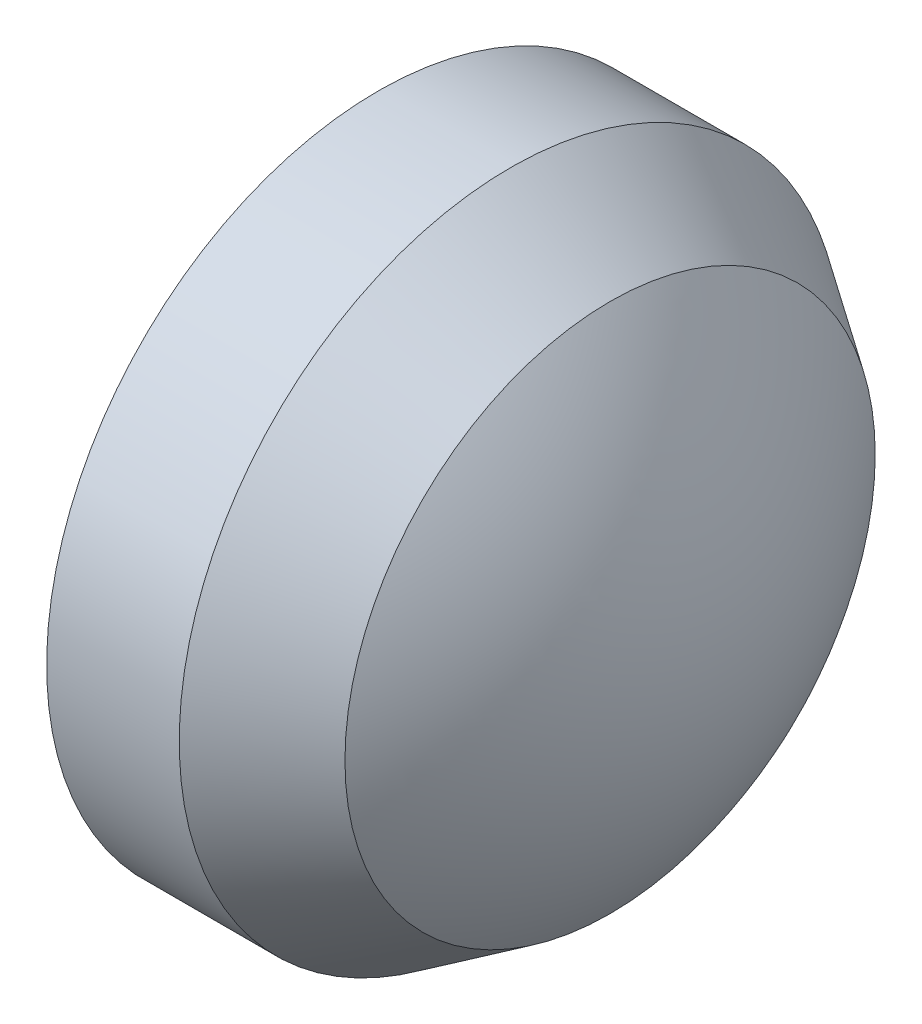
from build123d import *

# Parameters (mm, degrees)
SURFACE_EXTRUDE3_1_DEPTH = 20
THICKEN6_T1              = 2.5
BOSS_EXTRUDE2_DEPTH      = 20
SKETCH6_R                = 0.75
CUT_EXTRUDE1_DEPTH       = 74.484692283
BOSS_EXTRUDE4_REACH      = 75.485
THICKEN8_T1              = 2.5
BODY_MOVE_COPY1_ANGLE    = 45


# Read off the part's stored shape, not the designer's step: Thicken7
with BuildPart() as body_1:
    # Surface-Extrude3: a surface, the sketch's curves swept straight by 20 mm
    with BuildLine(Plane(origin=(0, 0, 0), x_dir=(0, 0, -1), z_dir=(1, 0, 0)), mode=Mode.PRIVATE) as surface_extrude3_1_path:
        CenterArc((0, 0), 50, 0, 360)
    surface_extrude3_1 = Shell.extrude(surface_extrude3_1_path.wire(), (1 * SURFACE_EXTRUDE3_1_DEPTH, 0 * SURFACE_EXTRUDE3_1_DEPTH, 0 * SURFACE_EXTRUDE3_1_DEPTH))
    add(Solid.thicken(surface_extrude3_1, THICKEN6_T1))

    # Sketch5 → Boss-Extrude2 (add)
    with BuildSketch(Plane(origin=(0, 0, 0), x_dir=(0, 0, -1), z_dir=(1, 0, 0))):
        with BuildLine():
            Line((2.5, 45), (2.5, 47.5))
            Line((2.5, 47.5), (-2.5, 47.5))
            Line((-2.5, 47.5), (-2.5, 45))
            ThreePointArc((-2.5, 45), (0, 42.5), (2.5, 45))
        make_face()
        with BuildLine():
            Line((-45, -2.5), (-47.5, -2.5))
            Line((-47.5, -2.5), (-47.5, 2.5))
            Line((-47.5, 2.5), (-45, 2.5))
            ThreePointArc((-45, 2.5), (-42.5, 0), (-45, -2.5))
        make_face()
        with BuildLine():
            Line((47.5, 2.5), (45, 2.5))
            ThreePointArc((45, 2.5), (42.5, 0), (45, -2.5))
            Line((45, -2.5), (47.5, -2.5))
            Line((47.5, -2.5), (47.5, 2.5))
        make_face()
        with BuildLine():
            Line((-2.5, -47.5), (2.5, -47.5))
            Line((2.5, -47.5), (2.5, -45))
            ThreePointArc((2.5, -45), (0, -42.5), (-2.5, -45))
            Line((-2.5, -45), (-2.5, -47.5))
        make_face()
    extrude(amount=BOSS_EXTRUDE2_DEPTH)

    # Sketch6 → Cut-Extrude1 (cut, through all)
    with BuildSketch(Plane(origin=(0, 0, 0), x_dir=(0, 0, -1), z_dir=(1, 0, 0))):
        with Locations((0, 45)):
            Circle(SKETCH6_R)
        with Locations((45, 0)):
            Circle(SKETCH6_R)
        with Locations((0, -45)):
            Circle(SKETCH6_R)
        with Locations((-45, 0)):
            Circle(SKETCH6_R)
    extrude(amount=CUT_EXTRUDE1_DEPTH, mode=Mode.SUBTRACT)

    # Thicken7 outline → Thicken7 (revolve)
    with BuildSketch(Plane.YX):
        Polygon((40, 35), (37.919874264, 33.613249509), (47.5, 19.243060906), (47.5, 20), (50, 20), align=None)
    revolve(axis=Axis((0, 0, 0), (1, 0, 0)))

    # Sketch10 → Boss-Extrude4 (add, up to next)
    with BuildSketch(Plane(origin=(20, 0, 0), x_dir=(0, 0, -1), z_dir=(1, 0, 0)), mode=Mode.PRIVATE) as boss_extrude4_sk1:
        with BuildLine():
            Line((-45, 2.5), (-46.92883092, 2.5))
            ThreePointArc((-46.92883092, 2.5), (-46.995373937, 0), (-46.92883092, -2.5))
            Line((-46.92883092, -2.5), (-45, -2.5))
            ThreePointArc((-45, -2.5), (-42.5, 0), (-45, 2.5))
        make_face()
    boss_extrude4_tool1 = extrude(boss_extrude4_sk1.sketch, amount=BOSS_EXTRUDE4_REACH, mode=Mode.PRIVATE) - body_1.part
    # Sketch10 → Boss-Extrude4 (add, up to next)
    with BuildSketch(Plane(origin=(20, 0, 0), x_dir=(0, 0, -1), z_dir=(1, 0, 0)), mode=Mode.PRIVATE) as boss_extrude4_sk2:
        with BuildLine():
            Line((-2.5, -45), (-2.5, -46.92883092))
            ThreePointArc((-2.5, -46.92883092), (0, -46.995373937), (2.5, -46.92883092))
            Line((2.5, -46.92883092), (2.5, -45))
            ThreePointArc((2.5, -45), (0, -42.5), (-2.5, -45))
        make_face()
    boss_extrude4_tool2 = extrude(boss_extrude4_sk2.sketch, amount=BOSS_EXTRUDE4_REACH, mode=Mode.PRIVATE) - body_1.part
    # Sketch10 → Boss-Extrude4 (add, up to next)
    with BuildSketch(Plane(origin=(20, 0, 0), x_dir=(0, 0, -1), z_dir=(1, 0, 0)), mode=Mode.PRIVATE) as boss_extrude4_sk3:
        with BuildLine():
            Line((45, -2.5), (46.92883092, -2.5))
            ThreePointArc((46.92883092, -2.5), (46.995373937, 0), (46.92883092, 2.5))
            Line((46.92883092, 2.5), (45, 2.5))
            ThreePointArc((45, 2.5), (42.5, 0), (45, -2.5))
        make_face()
    boss_extrude4_tool3 = extrude(boss_extrude4_sk3.sketch, amount=BOSS_EXTRUDE4_REACH, mode=Mode.PRIVATE) - body_1.part
    # Sketch10 → Boss-Extrude4 (add, up to next)
    with BuildSketch(Plane(origin=(20, 0, 0), x_dir=(0, 0, -1), z_dir=(1, 0, 0)), mode=Mode.PRIVATE) as boss_extrude4_sk4:
        with BuildLine():
            Line((2.5, 45), (2.5, 46.92883092))
            ThreePointArc((2.5, 46.92883092), (0, 46.995373937), (-2.5, 46.92883092))
            Line((-2.5, 46.92883092), (-2.5, 45))
            ThreePointArc((-2.5, 45), (0, 42.5), (2.5, 45))
        make_face()
    boss_extrude4_tool4 = extrude(boss_extrude4_sk4.sketch, amount=BOSS_EXTRUDE4_REACH, mode=Mode.PRIVATE) - body_1.part
    add(boss_extrude4_tool1.solids().sort_by_distance((20, 0, 44.965357))[0])
    add(boss_extrude4_tool2.solids().sort_by_distance((20, -44.965357, 0))[0])
    add(boss_extrude4_tool3.solids().sort_by_distance((20, 0, -44.965357))[0])
    add(boss_extrude4_tool4.solids().sort_by_distance((20, 44.965357, 0))[0])

    # Surface-Revolve3: a surface, the sketch's curves turned about an axis
    with BuildLine(Plane.XY, mode=Mode.PRIVATE) as surface_revolve3_2_path:
        add(Edge.make_bspline(
            [(35, 40), (50, 20), (50, 0)],
            knots=[0, 0, 0, 0.5, 0.5, 0.5], degree=2))
    surface_revolve3_2 = Shell.revolve(surface_revolve3_2_path.wire(), 360, Axis((50, 0, 0), (-1, 0, 0)))
    add(Solid.thicken(surface_revolve3_2, THICKEN8_T1))


with BuildPart() as body_1_1:
    # Body-Move/Copy1: moved
    add(body_1.part.rotate(Axis((0, 0, 0), (1, 0, 0)), BODY_MOVE_COPY1_ANGLE))


solid = body_1_1.part
